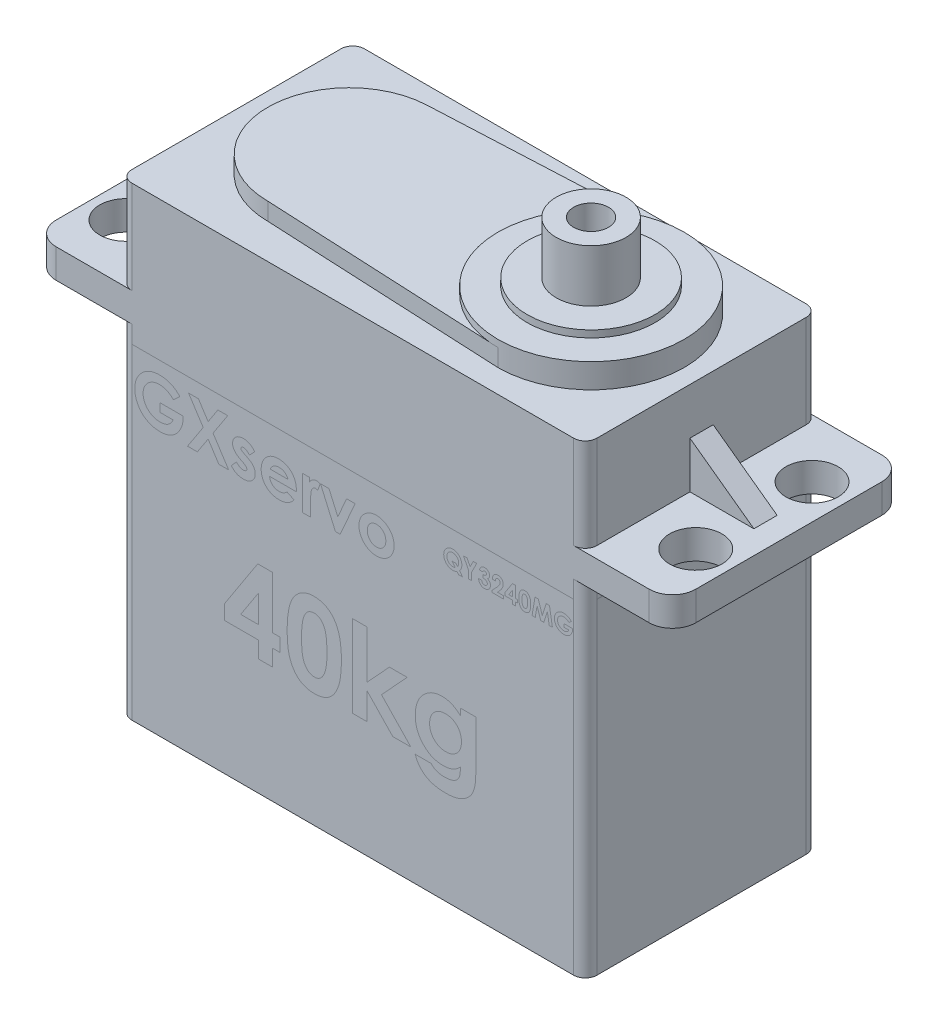
from build123d import *

# Parameters (mm, degrees)
SKETCH1_W           = 40
SKETCH1_H           = 20
BOSS_EXTRUDE1_DEPTH = 40
BOSS_EXTRUDE2_DEPTH = 1.5
SKETCH3_R           = 8
BOSS_EXTRUDE3_DEPTH = 0.6
SKETCH4_R           = 5.5
BOSS_EXTRUDE4_DEPTH = 0.6
SKETCH5_R           = 3
BOSS_EXTRUDE5_DEPTH = 4.5
SKETCH7_R           = 1.5
CUT_EXTRUDE1_DEPTH  = 8
BOSS_EXTRUDE6_START = -29.5
SKETCH16_R          = 2.25
BOSS_EXTRUDE6_DEPTH = 2.5
FILLET1_R           = 1
RIB2_START          = -1
RIB2_DEPTH          = 2
RIB11_REACH         = 57.535
SKETCH18_WALL_W     = 119.869902894
SKETCH18_WALL_H     = 2


# Read off the part's stored shape, not the designer's step: Rib2
with BuildPart() as part:
    # Sketch1 → Boss-Extrude1 (new body)
    with BuildSketch(Plane(origin=(0, 0, 0), x_dir=(1, 0, 0), z_dir=(0, 1, 0))):
        Rectangle(SKETCH1_W, SKETCH1_H)
    extrude(amount=BOSS_EXTRUDE1_DEPTH)

    # Sketch2 → Boss-Extrude2 (add)
    with BuildSketch(Plane(origin=(0, 40, 0), x_dir=(1, 0, 0), z_dir=(0, 1, 0))):
        with BuildLine():
            Line((9.738622033, 7.963686558), (-10.633481509, 6.992051922))
            ThreePointArc((-10.633481509, 6.992051922), (-17.298012698, -0.166788105), (-10.3, -7))
            Line((-10.3, -7), (9.732543123, -7.963103035))
            Line((9.732543123, -7.963103035), (10.5, -8))
            ThreePointArc((10.5, -8), (18.5, 0), (10.5, 8))
            Line((10.5, 8), (9.738622033, 7.963686558))
        make_face()
    extrude(amount=BOSS_EXTRUDE2_DEPTH)

    # Sketch3 → Boss-Extrude3 (add)
    with BuildSketch(Plane(origin=(0, 41.5, 0), x_dir=(1, 0, 0), z_dir=(0, 1, 0))):
        with Locations(Location((10.5, 0, 0), (0, 0, 270))):
            Circle(SKETCH3_R)
    extrude(amount=BOSS_EXTRUDE3_DEPTH)

    # Sketch4 → Boss-Extrude4 (add)
    with BuildSketch(Plane(origin=(0, 42.1, 0), x_dir=(1, 0, 0), z_dir=(0, 1, 0))):
        with Locations(Location((10.5, 0, 0), (0, 0, 270))):
            Circle(SKETCH4_R)
    extrude(amount=BOSS_EXTRUDE4_DEPTH)

    # Sketch5 → Boss-Extrude5 (add)
    with BuildSketch(Plane(origin=(0, 42.7, 0), x_dir=(1, 0, 0), z_dir=(0, 1, 0))):
        with Locations(Location((10.5, 0, 0), (0, 0, 270))):
            Circle(SKETCH5_R)
    extrude(amount=BOSS_EXTRUDE5_DEPTH)

    # Sketch7 → Cut-Extrude1 (cut)
    with BuildSketch(Plane(origin=(0, 47.2, 0), x_dir=(1, 0, 0), z_dir=(0, 1, 0))):
        with Locations(Location((10.5, 0, 0), (0, 0, 270))):
            Circle(SKETCH7_R)
    extrude(amount=-CUT_EXTRUDE1_DEPTH, mode=Mode.SUBTRACT)

    # Sketch16 → Boss-Extrude6 (add)
    # profile 1 of 2: a face of its own
    with BuildSketch(Plane.XZ.offset(BOSS_EXTRUDE6_START)):
        with BuildLine():
            Line((-20, 10), (-25.5, 10))
            ThreePointArc((-25.5, 10), (-26.914213562, 9.414213562), (-27.5, 8))
            Line((-27.5, 8), (-27.5, -8))
            ThreePointArc((-27.5, -8), (-26.914213562, -9.414213562), (-25.5, -10))
            Line((-25.5, -10), (-20, -10))
            Line((-20, -10), (-20, 10))
        make_face()
        with Locations(Location((-24.5, 5, 0), (0, 0, 270))):
            Circle(SKETCH16_R, mode=Mode.SUBTRACT)
        with Locations(Location((-24.5, -5, 0), (0, 0, 270))):
            Circle(SKETCH16_R, mode=Mode.SUBTRACT)
    # profile 2 of 2: a face of its own
    with BuildSketch(Plane.XZ.offset(BOSS_EXTRUDE6_START)):
        with BuildLine():
            Line((27.5, 8), (27.5, -8))
            ThreePointArc((27.5, -8), (26.914213562, -9.414213562), (25.5, -10))
            Line((25.5, -10), (20, -10))
            Line((20, -10), (20, 10))
            Line((20, 10), (25.5, 10))
            ThreePointArc((25.5, 10), (26.914213562, 9.414213562), (27.5, 8))
        make_face()
        with Locations(Location((24.5, -5, 0), (0, 0, 90))):
            Circle(SKETCH16_R, mode=Mode.SUBTRACT)
        with Locations(Location((24.5, 5, 0), (0, 0, 90))):
            Circle(SKETCH16_R, mode=Mode.SUBTRACT)
    extrude(amount=-BOSS_EXTRUDE6_DEPTH)

    # Fillet1
    fillet1_edges = [part.edges().sort_by_distance(p)[0] for p in [
        (-20, 14.75, 10),
        (-20, 14.75, -10),
        (20, 14.75, -10),
        (20, 14.75, 10),
        (20, 36, 10),
        (-20, 36, 10),
        (-20, 36, -10),
        (20, 36, -10),
    ]]
    fillet(fillet1_edges, radius=FILLET1_R)

    # Rib2 outline → Rib2 (add)
    with BuildSketch(Plane.XY.offset(RIB2_START)):
        Polygon((-20, 36), (-25.5, 32), (-20, 32), align=None)
    extrude(amount=RIB2_DEPTH)

    # Sketch18 wall → Rib11 (add, up to next)
    with BuildSketch(Plane(origin=(22.75, 34, 0), x_dir=(-0.808736084303, 0.588171697675, 0), z_dir=(-0.588171697675, -0.808736084303, 0)), mode=Mode.PRIVATE) as rib11_sk1:
        Rectangle(SKETCH18_WALL_W, SKETCH18_WALL_H)
    rib11_tool1 = extrude(rib11_sk1.sketch, amount=RIB11_REACH, mode=Mode.PRIVATE) - part.part
    add(rib11_tool1.solids().sort_by_distance((22.75, 34, 0))[0])


solid = part.part
